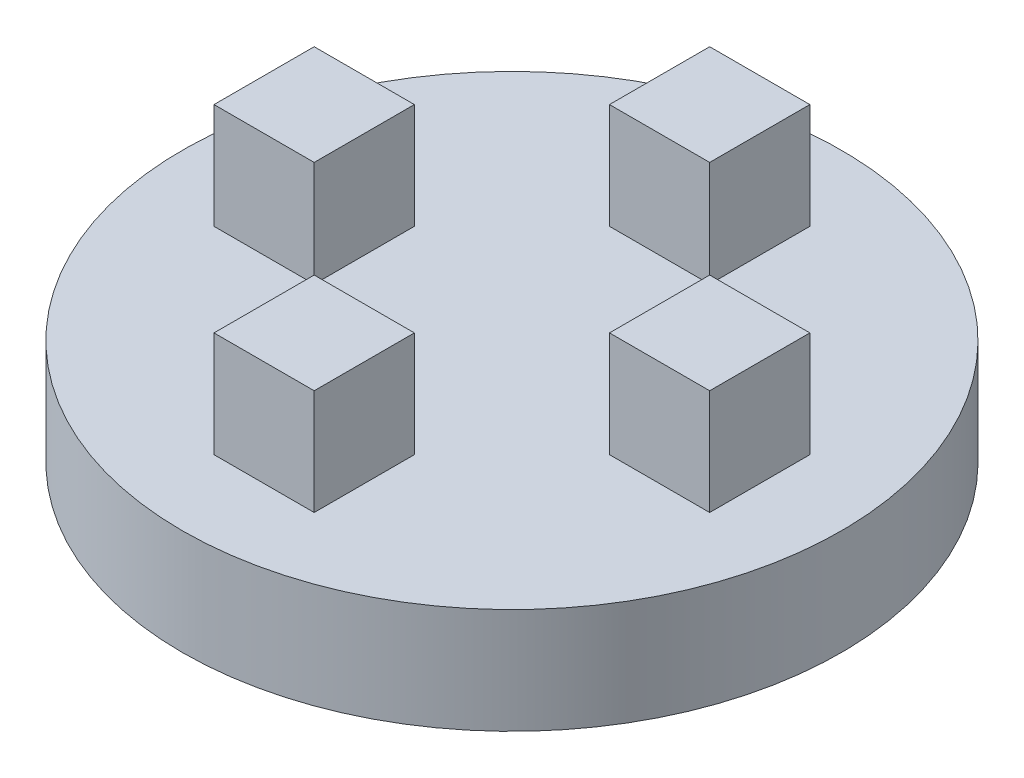
from build123d import *

# Parameters (mm, degrees)
SKETCH1_R           = 12.5
BOSS_EXTRUDE1_DEPTH = 2
SKETCH2_W           = 3.8
SKETCH2_H           = 3.8
BOSS_EXTRUDE3_DEPTH = 4
SKETCH3_R           = 5
BOSS_EXTRUDE4_DEPTH = 1
BOSS_EXTRUDE5_DEPTH = 5


with BuildPart() as part:
    # Sketch1 → Boss-Extrude1 (new, symmetric)
    with BuildSketch(Plane(origin=(0, 0, 0), x_dir=(1, 0, 0), z_dir=(0, 1, 0))):
        Circle(SKETCH1_R)
    extrude(amount=BOSS_EXTRUDE1_DEPTH, both=True)

    # Sketch2 → Boss-Extrude3 (add)
    with BuildSketch(Plane(origin=(0, 2, 0), x_dir=(1, 0, 0), z_dir=(0, 1, 0))):
        with Locations((0, 7.5)):
            Rectangle(SKETCH2_W, SKETCH2_H)
        with Locations((7.5, 0)):
            Rectangle(SKETCH2_W, SKETCH2_H)
        with Locations((0, -7.5)):
            Rectangle(SKETCH2_W, SKETCH2_H)
        with Locations((-7.5, 0)):
            Rectangle(SKETCH2_W, SKETCH2_H)
    extrude(amount=BOSS_EXTRUDE3_DEPTH)

    # Sketch3 → Boss-Extrude4 (add)
    with BuildSketch(Plane.XZ.offset(2)):
        Circle(SKETCH3_R)
    extrude(amount=BOSS_EXTRUDE4_DEPTH)

    # Sketch4 → Boss-Extrude5 (add)
    with BuildSketch(Plane.XZ.offset(3)):
        Polygon((0, -3.675), (3.182643359, -1.8375), (3.182643359, 1.8375), (0, 3.675), (-3.182643359, 1.8375), (-3.182643359, -1.8375), align=None)
    extrude(amount=BOSS_EXTRUDE5_DEPTH)


solid = part.part
